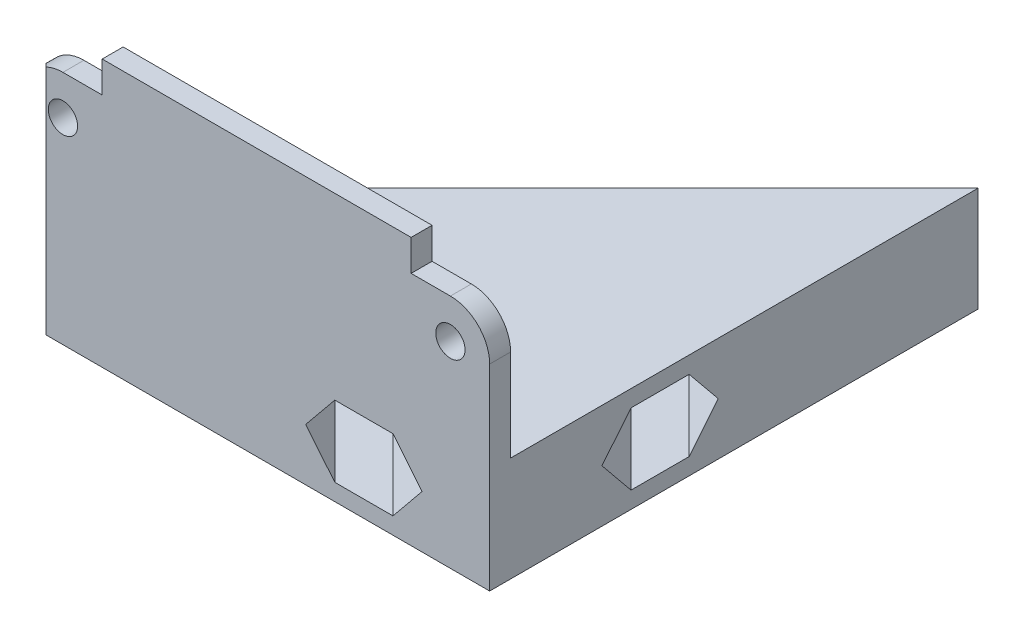
from build123d import *

# Parameters (mm, degrees)
SKETCH1_R           = 1.4
BOSS_EXTRUDE1_DEPTH = 2
BOSS_EXTRUDE2_START = -12.5
BOSS_EXTRUDE2_DEPTH = 10
SKETCH2_R           = 2
CUT_EXTRUDE1_DEPTH  = 40.088742751
CUT_EXTRUDE2_START  = -4
SKETCH2_3_R         = 2
CUT_EXTRUDE2_DEPTH  = 36.088742751
SKETCH4_W           = 3.030010437
SKETCH4_H           = 28.00665459
CUT_EXTRUDE3_DEPTH  = 40.088742751


# Read off the part's stored shape, not the designer's step: Boss-Extrude2
with BuildPart() as part:
    # Sketch1 → Boss-Extrude1 (new body)
    with BuildSketch(Plane.XY):
        with BuildLine():
            Line((7.5, -2.5), (7.5, 6.273123532))
            ThreePointArc((7.5, 6.273123532), (6.401650429, 8.924773961), (3.75, 10.023123532))
            Line((3.75, 10.023123532), (0, 10.023123532))
            Line((0, 10.023123532), (0, 13))
            Line((0, 13), (-29.5, 13))
            Line((-29.5, 13), (-29.5, 10.023123532))
            Line((-29.5, 10.023123532), (-33.25, 10.023123532))
            ThreePointArc((-33.25, 10.023123532), (-35.901650429, 8.924773961), (-37, 6.273123532))
            Line((-37, 6.273123532), (-37, -2.5))
            Line((-37, -2.5), (7.5, -2.5))
        make_face()
        with Locations((3.75, 6.273123532)):
            Circle(SKETCH1_R, mode=Mode.SUBTRACT)
        with Locations((-33.25, 6.273123532)):
            Circle(SKETCH1_R, mode=Mode.SUBTRACT)
    extrude(amount=BOSS_EXTRUDE1_DEPTH)

    # Boss-Extrude2 outline → Boss-Extrude2 (add)
    with BuildSketch(Plane(origin=(0, 0, 0), x_dir=(1, 0, 0), z_dir=(0, 1, 0)).offset(BOSS_EXTRUDE2_START)):
        Polygon((7.5, 44.633095244), (-37, 0.133095244), (-37, -2), (7.5, -2), align=None)
    extrude(amount=BOSS_EXTRUDE2_DEPTH)

    # Sketch2 → Cut-Extrude1 (cut, through all)
    with BuildSketch(Plane(origin=(-18.566547622, 0, -18.566547622), x_dir=(-0.7071067811865457, 0, 0.7071067811865495), z_dir=(-0.7071067811865495, 0, -0.7071067811865457))):
        with Locations((4.603838354, -7.5)):
            Circle(SKETCH2_R)
        with Locations((-15.396161646, -7.5)):
            Circle(SKETCH2_R)
    extrude(amount=-CUT_EXTRUDE1_DEPTH, mode=Mode.SUBTRACT)

    # Sketch2<3> → Cut-Extrude2 (cut, through all)
    # profile 1 of 2: a face of its own
    with BuildSketch(Plane(origin=(-18.566547622, 0, -18.566547622), x_dir=(-0.7071067811865457, 0, 0.7071067811865495), z_dir=(-0.7071067811865495, 0, -0.7071067811865457)).offset(CUT_EXTRUDE2_START)):
        Polygon((8.529820185, -7.5), (6.566829269, -4.1), (2.640847439, -4.1), (0.677856524, -7.5), (2.640847439, -10.9), (6.566829269, -10.9), align=None)
        with Locations((4.603838354, -7.5)):
            Circle(SKETCH2_3_R, mode=Mode.SUBTRACT)
    # profile 2 of 2: a face of its own
    with BuildSketch(Plane(origin=(-18.566547622, 0, -18.566547622), x_dir=(-0.7071067811865457, 0, 0.7071067811865495), z_dir=(-0.7071067811865495, 0, -0.7071067811865457)).offset(CUT_EXTRUDE2_START)):
        Polygon((-11.470179815, -7.5), (-13.433170731, -4.1), (-17.359152561, -4.1), (-19.322143476, -7.5), (-17.359152561, -10.9), (-13.433170731, -10.9), align=None)
        with Locations((-15.396161646, -7.5)):
            Circle(SKETCH2_3_R, mode=Mode.SUBTRACT)
    extrude(amount=-CUT_EXTRUDE2_DEPTH, mode=Mode.SUBTRACT)

    # Sketch4 → Cut-Extrude3 (cut, through all)
    with BuildSketch(Plane(origin=(-18.566547622, 0, -18.566547622), x_dir=(-0.7071067811865457, 0, 0.7071067811865495), z_dir=(-0.7071067811865495, 0, -0.7071067811865457))):
        with Locations((27.583843573, 1.503327295)):
            Rectangle(SKETCH4_W, SKETCH4_H)
    extrude(amount=-CUT_EXTRUDE3_DEPTH, mode=Mode.SUBTRACT)


solid = part.part
